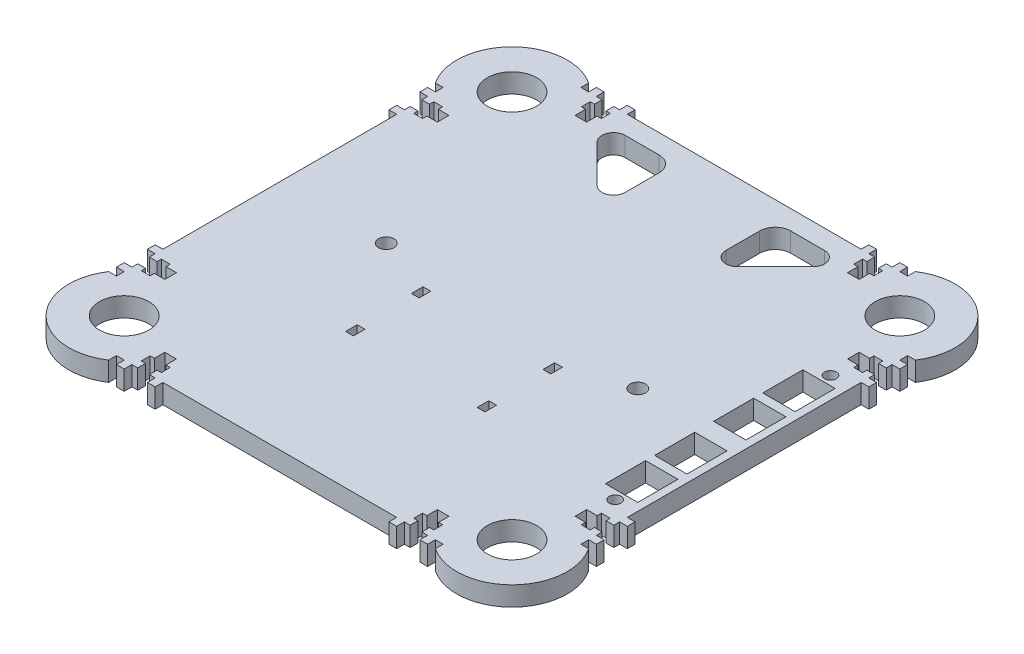
from build123d import *
from OCP.BRepAlgoAPI import BRepAlgoAPI_Cut
from OCP.TopTools import TopTools_ListOfShape

# Parameters (mm, degrees)
SKETCH1_W           = 120
SKETCH1_H           = 120
BOSS_EXTRUDE1_DEPTH = 5
BOSS_EXTRUDE3_DEPTH = 5
SKETCH3_R           = 6.375
CUT_EXTRUDE1_DEPTH  = 5
CUT_EXTRUDE4_DEPTH  = 10
CUT_EXTRUDE6_DEPTH  = 10
SKETCH9_W           = 2
SKETCH9_H           = 2
BOSS_EXTRUDE4_DEPTH = 5
CUT_EXTRUDE7_DEPTH  = 10
SKETCH11_W          = 2
SKETCH11_H          = 3
CUT_EXTRUDE9_DEPTH  = 5
SKETCH13_R          = 2
CUT_EXTRUDE10_DEPTH = 5
CUT_EXTRUDE11_DEPTH = 10
FILLET1_R           = 3
FILLET2_R           = 4
SKETCH17_R          = 1.524
SKETCH17_W          = 10.36
SKETCH17_H          = 8.35
CUT_EXTRUDE12_DEPTH = 10
SKETCH18_R          = 1.524
BOSS_EXTRUDE6_DEPTH = 5


with BuildPart() as part:
    # Sketch1 → Boss-Extrude1 (new body)
    with BuildSketch(Plane(origin=(0, 0, 0), x_dir=(1, 0, 0), z_dir=(0, 1, 0))):
        with Locations((60, 60)):
            Rectangle(SKETCH1_W, SKETCH1_H)
    extrude(amount=BOSS_EXTRUDE1_DEPTH)

    # Sketch2 → Boss-Extrude3 (add)
    with BuildSketch(Plane(origin=(0, 5, 0), x_dir=(1, 0, 0), z_dir=(0, 1, 0))):
        Polygon((100.201009868, 120), (120, 100.201010386), (134.142135439, 114.343146195), (114.343145306, 134.142135809), align=None)
        Polygon((0, 100.201010386), (-14.142135439, 114.343146195), (5.656854694, 134.142135809), (19.798990132, 120), align=None)
        Polygon((19.798990132, 0), (0, 19.798989614), (-14.142135439, 5.656853805), (5.656854694, -14.142135809), align=None)
        Polygon((120, 19.798989614), (134.142135439, 5.656853805), (114.343145306, -14.142135809), (100.201009868, 0), align=None)
    extrude(amount=-BOSS_EXTRUDE3_DEPTH)

    # Sketch3 → Cut-Extrude1 (cut)
    with BuildSketch(Plane(origin=(0, 5, 0), x_dir=(1, 0, 0), z_dir=(0, 1, 0))):
        with Locations((9.899495066, 9.899494807)):
            Circle(SKETCH3_R)
        with Locations((110.100504934, 9.899494807)):
            Circle(SKETCH3_R)
        with Locations((9.899495066, 110.100505193)):
            Circle(SKETCH3_R)
        with Locations((110.100504934, 110.100505193)):
            Circle(SKETCH3_R)
    extrude(amount=-CUT_EXTRUDE1_DEPTH, mode=Mode.SUBTRACT)


with BuildPart() as cut_extrude4_tool:
    # Sketch6 → Cut-Extrude4 (new body)
    with BuildSketch(Plane(origin=(0, 5, 0), x_dir=(1, 0, 0), z_dir=(0, 1, 0))):
        Polygon((0, 19.798989614), (0, 17.798989562), (-2, 17.798989562), align=None)
        Polygon((17.798989572, -1.99999991), (19.798989614, 1e-07), (17.798989562, 9e-08), align=None)
        Polygon((100.201010386, 1e-07), (102.201010438, 9e-08), (102.201010428, -1.99999991), align=None)
        Polygon((122, 17.798989562), (120, 19.798989614), (120, 17.798989562), align=None)
        Polygon((120, 100.201010386), (120, 102.201010438), (122, 102.201010438), align=None)
        Polygon((102.201010428, 121.99999991), (100.201010386, 119.9999999), (102.201010438, 119.99999991), align=None)
        Polygon((19.798989614, 119.9999999), (17.798989562, 119.99999991), (17.798989572, 121.99999991), align=None)
        Polygon((-2, 102.201010438), (0, 100.201010386), (0, 102.201010438), align=None)
    extrude(amount=-CUT_EXTRUDE4_DEPTH)


with BuildPart() as part_1:
    add(part.part)

    # Cut-Extrude4: cut by cut_extrude4_tool, with a tolerance
    cut_extrude4_stock = TopTools_ListOfShape()
    cut_extrude4_stock.Append(part_1.part.wrapped)
    cut_extrude4_tools = TopTools_ListOfShape()
    cut_extrude4_tools.Append(cut_extrude4_tool.part.wrapped)
    cut_extrude4_cut = BRepAlgoAPI_Cut()
    cut_extrude4_cut.SetArguments(cut_extrude4_stock)
    cut_extrude4_cut.SetTools(cut_extrude4_tools)
    cut_extrude4_cut.SetFuzzyValue(0.00001)
    cut_extrude4_cut.Build()
    add(Compound.cast(cut_extrude4_cut.Shape()).solids(), mode=Mode.REPLACE)


with BuildPart() as cut_extrude6_tool:
    # Sketch8 → Cut-Extrude6 (new body)
    with BuildSketch(Plane(origin=(0, 5, 0), x_dir=(1, 0, 0), z_dir=(0, 1, 0))):
        Polygon((23.298989562, 2), (23.298989562, 0), (26.298989562, 0), (26.298989562, 2), (27.398989562, 2), (27.398989562, 4.3), (26.298989562, 4.3), (26.298989562, 7), (23.298989562, 7), (23.298989562, 4.3), (22.198989562, 4.3), (22.198989562, 2), align=None)
        Polygon((93.701010438, 2), (93.701010438, 0), (96.701010438, 0), (96.701010438, 2), (97.801010438, 2), (97.801010438, 4.3), (96.701010438, 4.3), (96.701010438, 7), (93.701010438, 7), (93.701010438, 4.3), (92.601010438, 4.3), (92.601010438, 2), align=None)
        Polygon((96.701010438, 118), (96.701010438, 120), (93.701010438, 120), (93.701010438, 118), (92.601010438, 118), (92.601010438, 115.7), (93.701010438, 115.7), (93.701010438, 113), (96.701010438, 113), (96.701010438, 115.7), (97.801010438, 115.7), (97.801010438, 118), align=None)
        Polygon((26.298989562, 118), (26.298989562, 120), (23.298989562, 120), (23.298989562, 118), (22.198989562, 118), (22.198989562, 115.7), (23.298989562, 115.7), (23.298989562, 113), (26.298989562, 113), (26.298989562, 115.7), (27.398989562, 115.7), (27.398989562, 118), align=None)
        Polygon((2.000002013, 96.701013008), (2.013e-06, 96.701013061), (1.934e-06, 93.701013061), (2.000001934, 93.701013008), (2.000001905, 92.601013008), (4.300001905, 92.601012948), (4.300001934, 93.701012948), (7.000001934, 93.701012877), (7.000002013, 96.701012877), (4.300002013, 96.701012948), (4.300002041, 97.801012948), (2.000002041, 97.801013008), align=None)
        Polygon((2.00000017, 26.298992132), (1.7e-07, 26.298992184), (9.2e-08, 23.298992184), (2.000000092, 23.298992132), (2.000000063, 22.198992132), (4.300000063, 22.198992072), (4.300000092, 23.298992072), (7.000000092, 23.298992001), (7.00000017, 26.298992001), (4.30000017, 26.298992072), (4.300000199, 27.398992072), (2.000000199, 27.398992132), align=None)
        Polygon((118.000000092, 23.298989096), (120.000000092, 23.298989044), (120.00000017, 26.298989044), (118.00000017, 26.298989096), (118.000000199, 27.398989096), (115.700000199, 27.398989156), (115.70000017, 26.298989156), (113.00000017, 26.298989227), (113.000000092, 23.298989227), (115.700000092, 23.298989156), (115.700000063, 22.198989156), (118.000000063, 22.198989096), align=None)
        Polygon((118.000001934, 93.701009972), (120.000001934, 93.70100992), (120.000002013, 96.70100992), (118.000002013, 96.701009972), (118.000002041, 97.801009972), (115.700002041, 97.801010033), (115.700002013, 96.701010033), (113.000002013, 96.701010103), (113.000001934, 93.701010103), (115.700001934, 93.701010033), (115.700001905, 92.601010033), (118.000001905, 92.601009972), align=None)
    extrude(amount=-CUT_EXTRUDE6_DEPTH)


with BuildPart() as part_2:
    add(part_1.part)

    # Cut-Extrude6: cut by cut_extrude6_tool, with a tolerance
    cut_extrude6_stock = TopTools_ListOfShape()
    cut_extrude6_stock.Append(part_2.part.wrapped)
    cut_extrude6_tools = TopTools_ListOfShape()
    cut_extrude6_tools.Append(cut_extrude6_tool.part.wrapped)
    cut_extrude6_cut = BRepAlgoAPI_Cut()
    cut_extrude6_cut.SetArguments(cut_extrude6_stock)
    cut_extrude6_cut.SetTools(cut_extrude6_tools)
    cut_extrude6_cut.SetFuzzyValue(0.00001)
    cut_extrude6_cut.Build()
    add(Compound.cast(cut_extrude6_cut.Shape()).solids(), mode=Mode.REPLACE)


with BuildPart() as boss_extrude4_tool:
    # Sketch9 → Boss-Extrude4 (new body)
    with BuildSketch(Plane(origin=(0, 5, 0), x_dir=(1, 0, 0), z_dir=(0, 1, 0))):
        with Locations((-0.999998536, 99.201012877)):
            Rectangle(SKETCH9_W, SKETCH9_H)
        with Locations((-0.999998536, 91.201012877)):
            Rectangle(SKETCH9_W, SKETCH9_H)
        Polygon((19.798989745, 120.000000641), (19.798989797, 122.000000641), (21.798989797, 122.000000588), (21.798989745, 120.000000588), align=None)
        Polygon((27.798989745, 120.000000431), (29.798989745, 120.000000379), (29.798989797, 122.000000379), (27.798989797, 122.000000431), align=None)
        Polygon((92.201010255, 120.000000431), (92.201010203, 122.000000431), (90.201010203, 122.000000379), (90.201010255, 120.000000379), align=None)
        Polygon((98.201010255, 120.000000588), (100.201010255, 120.000000641), (100.201010203, 122.000000641), (98.201010203, 122.000000588), align=None)
        with Locations((120.999998536, 99.201012877)):
            Rectangle(SKETCH9_W, SKETCH9_H)
        with Locations((120.999998536, 91.201012877)):
            Rectangle(SKETCH9_W, SKETCH9_H)
        with Locations((120.999998536, 28.798986086)):
            Rectangle(SKETCH9_W, SKETCH9_H)
        with Locations((120.999998536, 20.798986086)):
            Rectangle(SKETCH9_W, SKETCH9_H)
        Polygon((98.201010255, -1.625e-06), (98.201010203, -2.000001625), (100.201010203, -2.000001677), (100.201010255, -1.677e-06), align=None)
        Polygon((92.201010255, -1.467e-06), (90.201010255, -1.415e-06), (90.201010203, -2.000001415), (92.201010203, -2.000001467), align=None)
        Polygon((27.798989745, -1.467e-06), (27.798989797, -2.000001467), (29.798989797, -2.000001415), (29.798989745, -1.415e-06), align=None)
        Polygon((21.798989745, -1.625e-06), (19.798989745, -1.677e-06), (19.798989797, -2.000001677), (21.798989797, -2.000001625), align=None)
        with Locations((-0.999998536, 20.798986086)):
            Rectangle(SKETCH9_W, SKETCH9_H)
        with Locations((-0.999998536, 28.798986086)):
            Rectangle(SKETCH9_W, SKETCH9_H)
    extrude(amount=-BOSS_EXTRUDE4_DEPTH)


with BuildPart() as part_3:
    add(part_2.part)


with BuildPart() as part_4:
    # Boss-Extrude4: joined with boss_extrude4_tool
    add(part_3.part.fuse(boss_extrude4_tool.part, tol=0.00001))


with BuildPart() as cut_extrude7_tool:
    # Sketch10 → Cut-Extrude7 (new body)
    with BuildSketch(Plane(origin=(0, 5, 0), x_dir=(1, 0, 0), z_dir=(0, 1, 0))):
        with BuildLine():
            Line((-1.999999486, 102.201010438), (-14.142135439, 114.343146195))
            Line((-14.142135439, 114.343146195), (5.656854694, 134.142135809))
            Line((5.656854694, 134.142135809), (17.798989572, 121.99999991))
            ThreePointArc((17.798989572, 121.99999991), (-0.20000968, 120.200009728), (-1.999999486, 102.201010438))
        make_face()
        with BuildLine():
            Line((-14.142135439, 5.656852769), (5.656854694, -14.142136845))
            Line((5.656854694, -14.142136845), (17.798989572, -2.000000946))
            ThreePointArc((17.798989572, -2.000000946), (-0.20000968, -0.200010764), (-1.999999486, 17.798988525))
            Line((-1.999999486, 17.798988525), (-14.142135439, 5.656852769))
        make_face()
        with BuildLine():
            Line((121.999999459, 17.798988525), (134.142135412, 5.656852769))
            Line((134.142135412, 5.656852769), (114.34314528, -14.142136845))
            Line((114.34314528, -14.142136845), (102.201010402, -2.000000946))
            ThreePointArc((102.201010402, -2.000000946), (120.200009654, -0.200010764), (121.999999459, 17.798988525))
        make_face()
        with BuildLine():
            Line((134.142135412, 114.343146195), (114.34314528, 134.142135809))
            Line((114.34314528, 134.142135809), (102.201010402, 121.99999991))
            ThreePointArc((102.201010402, 121.99999991), (120.200009654, 120.200009728), (121.999999459, 102.201010438))
            Line((121.999999459, 102.201010438), (134.142135412, 114.343146195))
        make_face()
    extrude(amount=-CUT_EXTRUDE7_DEPTH)


with BuildPart() as part_5:
    add(part_4.part)

    # Cut-Extrude7: cut by cut_extrude7_tool, with a tolerance
    cut_extrude7_stock = TopTools_ListOfShape()
    cut_extrude7_stock.Append(part_5.part.wrapped)
    cut_extrude7_tools = TopTools_ListOfShape()
    cut_extrude7_tools.Append(cut_extrude7_tool.part.wrapped)
    cut_extrude7_cut = BRepAlgoAPI_Cut()
    cut_extrude7_cut.SetArguments(cut_extrude7_stock)
    cut_extrude7_cut.SetTools(cut_extrude7_tools)
    cut_extrude7_cut.SetFuzzyValue(0.00001)
    cut_extrude7_cut.Build()
    add(Compound.cast(cut_extrude7_cut.Shape()).solids(), mode=Mode.REPLACE)

    # Sketch11 → Cut-Extrude9 (cut)
    with BuildSketch(Plane(origin=(0, 5, 0), x_dir=(1, 0, 0), z_dir=(0, 1, 0))):
        with Locations((76.999999987, 53.5)):
            Rectangle(SKETCH11_W, SKETCH11_H)
        with Locations((76.999999987, 36.5)):
            Rectangle(SKETCH11_W, SKETCH11_H)
        with Locations((42.999999987, 36.5)):
            Rectangle(SKETCH11_W, SKETCH11_H)
        with Locations((42.999999987, 53.5)):
            Rectangle(SKETCH11_W, SKETCH11_H)
    extrude(amount=-CUT_EXTRUDE9_DEPTH, mode=Mode.SUBTRACT)

    # Sketch13 → Cut-Extrude10 (cut)
    with BuildSketch(Plane(origin=(0, 5, 0), x_dir=(1, 0, 0), z_dir=(0, 1, 0))):
        with Locations((92.499999987, 60)):
            Circle(SKETCH13_R)
        with Locations((27.499999987, 60)):
            Circle(SKETCH13_R)
    extrude(amount=-CUT_EXTRUDE10_DEPTH, mode=Mode.SUBTRACT)

    # Sketch14 → Cut-Extrude11 (cut)
    with BuildSketch(Plane(origin=(0, 5, 0), x_dir=(1, 0, 0), z_dir=(0, 1, 0))):
        Polygon((47, 95), (27, 115), (47, 115), align=None)
        Polygon((93, 115), (73, 115), (73, 95), align=None)
    extrude(amount=-CUT_EXTRUDE11_DEPTH, mode=Mode.SUBTRACT)

    # Fillet1
    fillet1_edges = [part_5.edges().sort_by_distance(p)[0] for p in [
        (93, 2.5, -115),
        (73, 2.5, -95),
        (47, 2.5, -95),
        (27, 2.5, -115),
    ]]
    fillet(fillet1_edges, radius=FILLET1_R)

    # Fillet2
    fillet2_edges = [part_5.edges().sort_by_distance(p)[0] for p in [
        (47, 2.5, -115),
        (73, 2.5, -115),
    ]]
    fillet(fillet2_edges, radius=FILLET2_R)

    # Sketch17 → Cut-Extrude12 (cut)
    with BuildSketch(Plane(origin=(191.572036602, 5, 58.017716905), x_dir=(0, 0, -1), z_dir=(0, 1, 0))):
        with Locations((90.202716387, 96.402036602)):
            Circle(SKETCH17_R)
        with Locations((90.202716387, 77.102036602)):
            Circle(SKETCH17_R)
        with Locations((145.832716387, 77.102036602)):
            Circle(SKETCH17_R)
        with Locations((145.832716387, 96.402036602)):
            Circle(SKETCH17_R)
        with Locations((125.637716387, 77.747036602)):
            Rectangle(SKETCH17_W, SKETCH17_H)
        with Locations((97.697716387, 77.747036602)):
            Rectangle(SKETCH17_W, SKETCH17_H)
        with Locations((138.337716387, 77.747036602)):
            Rectangle(SKETCH17_W, SKETCH17_H)
        with Locations((110.397716387, 77.747036602)):
            Rectangle(SKETCH17_W, SKETCH17_H)
    extrude(amount=-CUT_EXTRUDE12_DEPTH, mode=Mode.SUBTRACT)

    # Sketch18 → Boss-Extrude6 (add)
    with BuildSketch(Plane(origin=(0, 5, 0), x_dir=(1, 0, 0), z_dir=(0, 1, 0))):
        with Locations((95.17, 87.814999482)):
            Circle(SKETCH18_R)
        with Locations((95.17, 32.184999482)):
            Circle(SKETCH18_R)
    extrude(amount=-BOSS_EXTRUDE6_DEPTH)


solid = part_5.part
